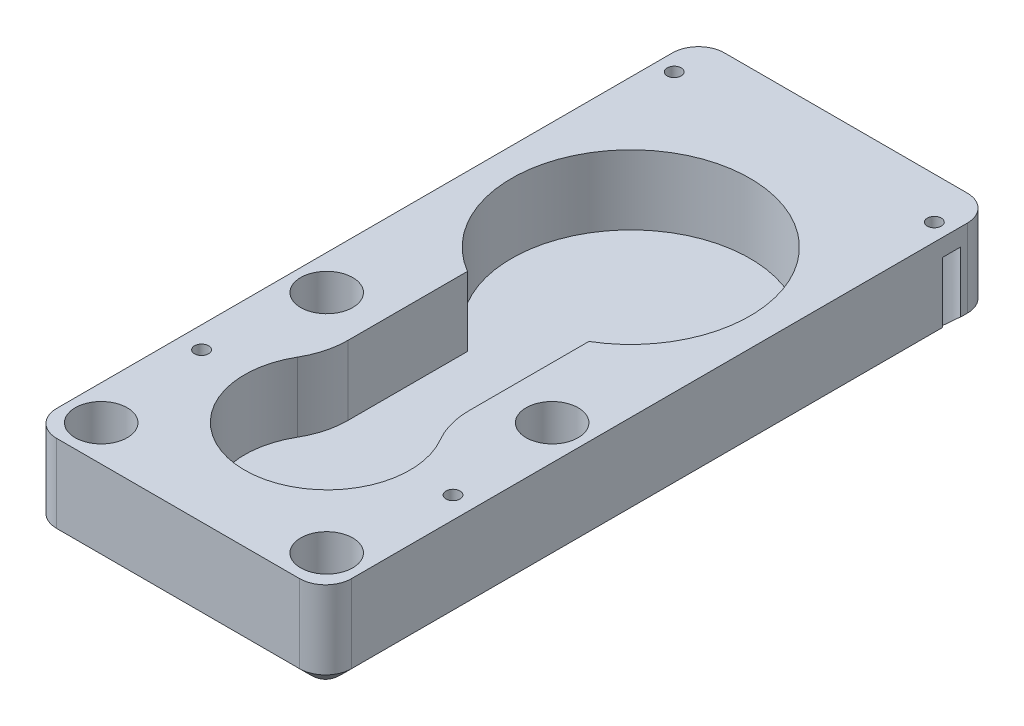
from build123d import *

# Parameters (mm, degrees)
EXTRUDE_1_DEPTH     = 12
SKETCH_2_R          = 3
SKETCH_2_R_2        = 0.81
CUT_EXTRUDE_1_DEPTH = 12
CUT_EXTRUDE_2_DEPTH = 8
FILLET_1_R          = 3
SKETCH_4_R          = 2.25
CUT_EXTRUDE_3_DEPTH = 10
CHAMFER_3_SIZE      = 3


with BuildPart() as part:
    # 草图1 → 凸台-拉伸1 (new body)
    with BuildSketch(Plane(origin=(0, 0, 0), x_dir=(1, 0, 0), z_dir=(0, 1, 0))):
        with BuildLine():
            Line((0, 0), (28, 0))
            ThreePointArc((28, 0), (30.121320344, 0.878679656), (31, 3))
            Line((31, 3), (31, 77))
            Line((31, 77), (-3, 77))
            Line((-3, 77), (-3, 3))
            ThreePointArc((-3, 3), (-2.121320344, 0.878679656), (0, 0))
        make_face()
    extrude(amount=EXTRUDE_1_DEPTH)

    # 草图2 → 切除-拉伸1 (cut)
    with BuildSketch(Plane(origin=(14.000000253, 12, -382.2), x_dir=(1, 0, 0), z_dir=(0, 1, 0))):
        with Locations(Location((13, -352.069110398, 0), (0, 0, 270))):
            Circle(SKETCH_2_R)
        with Locations(Location((-13, -352.069110398, 0), (0, 0, 270))):
            Circle(SKETCH_2_R)
        with Locations(Location((13, -378.069110398, 0), (0, 0, 270))):
            Circle(SKETCH_2_R)
        with Locations(Location((-13, -378.069110398, 0), (0, 0, 270))):
            Circle(SKETCH_2_R)
        with Locations(Location((-15.000000143, -309.999984702, 0), (0, 0, 270))):
            Circle(SKETCH_2_R_2)
        with Locations(Location((15.000000143, -309.999984702, 0), (0, 0, 270))):
            Circle(SKETCH_2_R_2)
        with Locations(Location((14.500000253, -365.000006616, 0), (0, 0, 270))):
            Circle(SKETCH_2_R_2)
        with Locations(Location((-14.500000253, -365.000006616, 0), (0, 0, 270))):
            Circle(SKETCH_2_R_2)
    extrude(amount=-CUT_EXTRUDE_1_DEPTH, mode=Mode.SUBTRACT)

    # 草图3 → 切除-拉伸2 (cut)
    with BuildSketch(Plane(origin=(14.000000253, 12, -382.2), x_dir=(1, 0, 0), z_dir=(0, 1, 0))):
        with BuildLine():
            Line((-7.000000134, -341.834781862), (-7.000000134, -355.639881164))
            ThreePointArc((-7.000000134, -355.639881164), (-7.313370109, -357.994123887), (-8.231657645, -360.184422392))
            ThreePointArc((-8.231657645, -360.184422392), (0, -374.536779603), (8.231657645, -360.184422392))
            ThreePointArc((8.231657645, -360.184422392), (7.313370109, -357.994123887), (7.000000134, -355.639881164))
            Line((7.000000134, -355.639881164), (7.000000134, -341.834782031))
            ThreePointArc((7.000000134, -341.834782031), (3.09e-07, -316.249981647), (-7.000000134, -341.834781862))
        make_face()
    extrude(amount=-CUT_EXTRUDE_2_DEPTH, mode=Mode.SUBTRACT)

    # 圆角1
    fillet_1_edges = [part.edges().sort_by_distance(p)[0] for p in [
        (-3, 6, -77),
        (31, 6, -77),
    ]]
    fillet(fillet_1_edges, radius=FILLET_1_R)

    # 草图4 → 切除-拉伸3 (cut)
    with BuildSketch(Plane.XZ):
        with Locations(Location((-0.5, -17.199993384, 0), (0, 0, 270))):
            Circle(SKETCH_4_R)
        with Locations(Location((28.500000507, -17.199993384, 0), (0, 0, 270))):
            Circle(SKETCH_4_R)
        with Locations((-0.99999989, -72.200015298)):
            Circle(SKETCH_4_R)
        with Locations((29.000000396, -72.200015298)):
            Circle(SKETCH_4_R)
    extrude(amount=-CUT_EXTRUDE_3_DEPTH, mode=Mode.SUBTRACT)

    # 倒角3
    # the kernel refuses this chamfer: 3 mm, written as the material it takes off along each edge
    with BuildSketch(Plane(origin=(0, 0, -74), x_dir=(-1, 0, 0), z_dir=(0, 0, 1))) as chamfer_3_piece_1:
        with BuildLine():
            Line((3 - CHAMFER_3_SIZE, 0), (3.084852814, -3.084852814))
            Line((3.084852814, -3.084852814), (3.144852814, -3.084852814))
            ThreePointArc((3.144852814, -3.084852814), (3.06, -1.542426407), (3.06, 0))
            Line((3.06, 0), (3, 0.06))
            Line((3, 0.06), (0, 0.142518829))
            Line((0, 0.142518829), (3 - CHAMFER_3_SIZE, 0))
        make_face()
    revolve(axis=Axis((0, 0, -74), (0, -1, 0)), revolution_arc=90, mode=Mode.SUBTRACT)
    with BuildSketch(Plane(origin=(-3, 0, -74), x_dir=(1, 0, 0), z_dir=(0, 0, 1))) as chamfer_3_piece_2:
        with BuildLine():
            Line((3.084852814, -0.084852814), (-0.084852814, 3.084852814))
            Line((-0.084852814, 3.084852814), (-0.144852814, 3.084852814))
            ThreePointArc((-0.144852814, 3.084852814), (-0.06, 1.542426407), (-0.06, 0))
            Line((-0.06, 0), (0, -0.06))
            ThreePointArc((0, -0.06), (1.542426407, -0.06), (3.084852814, -0.144852814))
            Line((3.084852814, -0.144852814), (3.084852814, -0.084852814))
        make_face()
    extrude(amount=8.484257474, mode=Mode.SUBTRACT)
    with BuildSketch(Plane(origin=(31, 0, -65.515743509), x_dir=(-1, 0, 0), z_dir=(0, 0, -1))) as chamfer_3_piece_3:
        with BuildLine():
            Line((3.084852814, -0.084852814), (-0.084852814, 3.084852814))
            Line((-0.084852814, 3.084852814), (-0.144852814, 3.084852814))
            ThreePointArc((-0.144852814, 3.084852814), (-0.06, 1.542426407), (-0.06, 0))
            Line((-0.06, 0), (0, -0.06))
            ThreePointArc((0, -0.06), (1.542426407, -0.06), (3.084852814, -0.144852814))
            Line((3.084852814, -0.144852814), (3.084852814, -0.084852814))
        make_face()
    extrude(amount=8.484256491, mode=Mode.SUBTRACT)
    with BuildSketch(Plane(origin=(28, 0, -74), x_dir=(1, 0, 0), z_dir=(0, 0, 1))) as chamfer_3_piece_4:
        with BuildLine():
            Line((3 - CHAMFER_3_SIZE, 0), (3.084852814, 3.084852814))
            Line((3.084852814, 3.084852814), (3.144852814, 3.084852814))
            ThreePointArc((3.144852814, 3.084852814), (3.06, 1.542426407), (3.06, 0))
            Line((3.06, 0), (3, -0.06))
            Line((3, -0.06), (0, -0.142518829))
            Line((0, -0.142518829), (3 - CHAMFER_3_SIZE, 0))
        make_face()
    revolve(axis=Axis((28, 0, -74), (0, 1, 0)), revolution_arc=90, mode=Mode.SUBTRACT)
    with BuildSketch(Plane(origin=(28, 0, -77), x_dir=(0, 0, 1), z_dir=(-1, 0, 0))) as chamfer_3_piece_5:
        with BuildLine():
            Line((3.084852814, -0.084852814), (-0.084852814, 3.084852814))
            Line((-0.084852814, 3.084852814), (-0.144852814, 3.084852814))
            ThreePointArc((-0.144852814, 3.084852814), (-0.06, 1.542426407), (-0.06, 0))
            Line((-0.06, 0), (0, -0.06))
            ThreePointArc((0, -0.06), (1.542426407, -0.06), (3.084852814, -0.144852814))
            Line((3.084852814, -0.144852814), (3.084852814, -0.084852814))
        make_face()
    extrude(amount=28, mode=Mode.SUBTRACT)
    # the kernel refuses this chamfer: 3 mm, written as the material it takes off along each edge
    with BuildSketch(Plane(origin=(-3, 0, -73.23079149), x_dir=(0, 1, 0), z_dir=(0, 0, 1))) as chamfer_3_2_piece_1:
        with BuildLine():
            Line((3.084852814, 0.084852814), (-0.084852814, -3.084852814))
            Line((-0.084852814, -3.084852814), (-0.144852814, -3.084852814))
            ThreePointArc((-0.144852814, -3.084852814), (-0.06, -1.542426407), (-0.06, 0))
            Line((-0.06, 0), (0, 0.06))
            ThreePointArc((0, 0.06), (1.542426407, 0.06), (3.084852814, 0.144852814))
            Line((3.084852814, 0.144852814), (3.084852814, 0.084852814))
        make_face()
    extrude(amount=70.23079149, mode=Mode.SUBTRACT)
    with BuildSketch(Plane(origin=(0, 0, -3), x_dir=(-1, 0, 0), z_dir=(0, 0, -1))) as chamfer_3_2_piece_2:
        with BuildLine():
            Line((3 - CHAMFER_3_SIZE, 0), (3.084852814, 3.084852814))
            Line((3.084852814, 3.084852814), (3.144852814, 3.084852814))
            ThreePointArc((3.144852814, 3.084852814), (3.06, 1.542426407), (3.06, 0))
            Line((3.06, 0), (3, -0.06))
            Line((3, -0.06), (0, -0.142518829))
            Line((0, -0.142518829), (3 - CHAMFER_3_SIZE, 0))
        make_face()
    revolve(axis=Axis((0, 0, -3), (0, 1, 0)), revolution_arc=90, mode=Mode.SUBTRACT)
    with BuildSketch(Plane(origin=(0, 0, 0), x_dir=(0, 0, -1), z_dir=(1, 0, 0))) as chamfer_3_2_piece_3:
        with BuildLine():
            Line((3.084852814, -0.084852814), (-0.084852814, 3.084852814))
            Line((-0.084852814, 3.084852814), (-0.144852814, 3.084852814))
            ThreePointArc((-0.144852814, 3.084852814), (-0.06, 1.542426407), (-0.06, 0))
            Line((-0.06, 0), (0, -0.06))
            ThreePointArc((0, -0.06), (1.542426407, -0.06), (3.084852814, -0.144852814))
            Line((3.084852814, -0.144852814), (3.084852814, -0.084852814))
        make_face()
    extrude(amount=28, mode=Mode.SUBTRACT)
    with BuildSketch(Plane(origin=(28, 0, -3), x_dir=(0, 0, 1), z_dir=(-1, 0, 0))) as chamfer_3_2_piece_4:
        with BuildLine():
            Line((3 - CHAMFER_3_SIZE, 0), (3.084852814, 3.084852814))
            Line((3.084852814, 3.084852814), (3.144852814, 3.084852814))
            ThreePointArc((3.144852814, 3.084852814), (3.06, 1.542426407), (3.06, 0))
            Line((3.06, 0), (3, -0.06))
            Line((3, -0.06), (0, -0.142518829))
            Line((0, -0.142518829), (3 - CHAMFER_3_SIZE, 0))
        make_face()
    revolve(axis=Axis((28, 0, -3), (0, 1, 0)), revolution_arc=90, mode=Mode.SUBTRACT)
    with BuildSketch(Plane(origin=(31, 0, -3), x_dir=(-1, 0, 0), z_dir=(0, 0, -1))) as chamfer_3_2_piece_5:
        with BuildLine():
            Line((3.084852814, -0.084852814), (-0.084852814, 3.084852814))
            Line((-0.084852814, 3.084852814), (-0.144852814, 3.084852814))
            ThreePointArc((-0.144852814, 3.084852814), (-0.06, 1.542426407), (-0.06, 0))
            Line((-0.06, 0), (0, -0.06))
            ThreePointArc((0, -0.06), (1.542426407, -0.06), (3.084852814, -0.144852814))
            Line((3.084852814, -0.144852814), (3.084852814, -0.084852814))
        make_face()
    extrude(amount=70.230792473, mode=Mode.SUBTRACT)


solid = part.part
